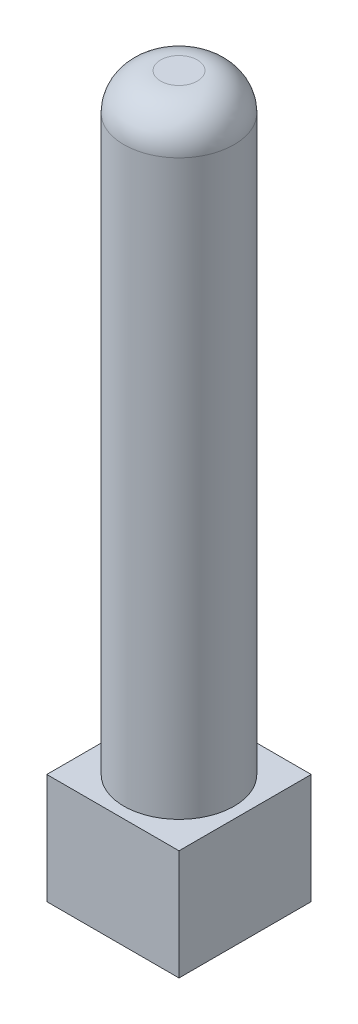
from build123d import *

# Parameters (mm, degrees)
ESQUISSE1_R        = 1.5
BOSS_EXTRU_1_DEPTH = 16.6
ESQUISSE3_W        = 3.6
ESQUISSE3_H        = 3.6
BOSS_EXTRU_2_DEPTH = 3
CONG_2_R           = 1


with BuildPart() as part:
    # Esquisse1 → Boss.-Extru.1 (new body)
    with BuildSketch(Plane(origin=(0, 0, 0), x_dir=(1, 0, 0), z_dir=(0, 1, 0))):
        Circle(ESQUISSE1_R)
    extrude(amount=BOSS_EXTRU_1_DEPTH)

    # Esquisse3 → Boss.-Extru.2 (add)
    with BuildSketch(Plane(origin=(0, 0, 0), x_dir=(1, 0, 0), z_dir=(0, 1, 0))):
        Rectangle(ESQUISSE3_W, ESQUISSE3_H)
    extrude(amount=-BOSS_EXTRU_2_DEPTH)

    # Congé2
    cong_2_edges = [part.edges().sort_by_distance(p)[0] for p in [
        (-1.5, 16.6, 0),
    ]]
    fillet(cong_2_edges, radius=CONG_2_R)


solid = part.part
